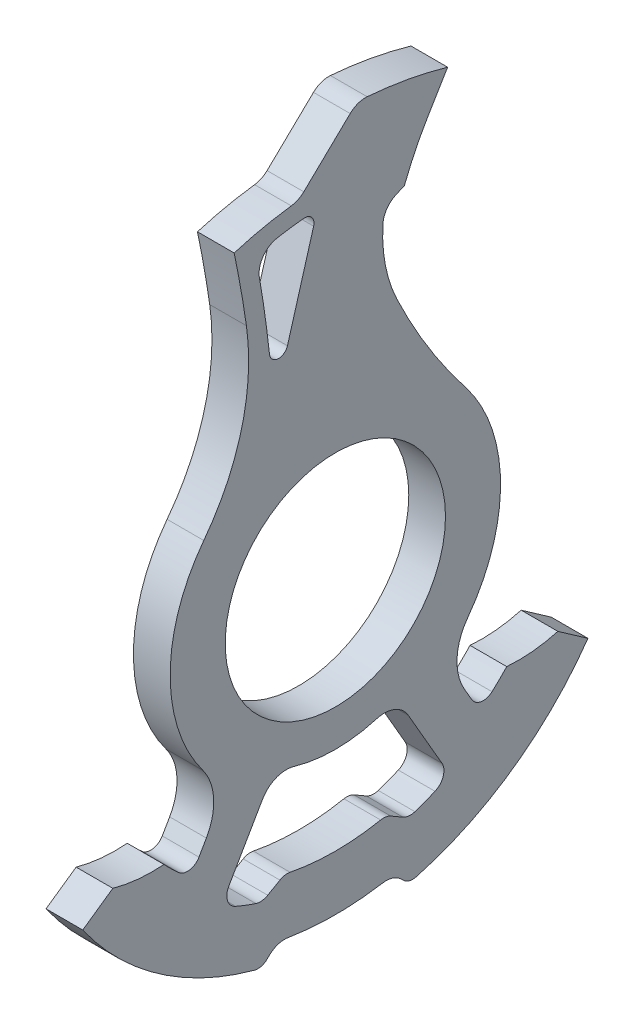
from build123d import *

# Parameters (mm, degrees)
SKETCH2_R           = 38.1
BOSS_EXTRUDE1_DEPTH = 6.35
CUT_EXTRUDE1_DEPTH  = 166.096382574
FILLET1_R           = 7.62
FILLET4_R           = 19.05
FILLET2_R           = 4.572
CUT_EXTRUDE2_DEPTH  = 165.922168179
FILLET3_R           = 5.08
FILLET5_R           = 9.525


with BuildPart() as part:
    # Sketch2 → Boss-Extrude1 (new, symmetric)
    with BuildSketch(Plane(origin=(0, 0, 0), x_dir=(0, 0, -1), z_dir=(1, 0, 0))):
        with BuildLine():
            Line((38.857972086, 134.186988957), (32.288511437, 123.318125779))
            ThreePointArc((32.288511437, 123.318125779), (27.710359244, 114.938607951), (23.879951403, 106.191964463))
            Line((23.879951403, 106.191964463), (16.910644846, 103.110866265))
            Line((16.910644846, 103.110866265), (16.656554589, 100.752761272))
            ThreePointArc((16.656554589, 100.752761272), (17.081157757, 86.805782836), (21.28431641, 73.500447339))
            ThreePointArc((21.28431641, 73.500447339), (32.060560856, 53.735826371), (44.956935904, 35.284506715))
            ThreePointArc((44.956935904, 35.284506715), (56.9039122, -5.297855828), (37.670623819, -42.977280057))
            Line((37.670623819, -42.977280057), (49.900086632, -64.159330998))
            ThreePointArc((49.900086632, -64.159330998), (54.760018309, -60.06478831), (59.285209805, -55.603078137))
            ThreePointArc((59.285209805, -55.603078137), (68.209440684, -55.534234835), (76.983909122, -53.904713488))
            Line((76.983909122, -53.904713488), (87.387140085, -61.18913423))
            ThreePointArc((87.387140085, -61.18913423), (60.250819498, -88.036703424), (25.4, -103.612076516))
            Line((25.4, -103.612076516), (20.08663208, -98.298708596))
            ThreePointArc((20.08663208, -98.298708596), (0, -100.33), (-20.08663208, -98.298708596))
            Line((-20.08663208, -98.298708596), (-25.4, -103.612076516))
            ThreePointArc((-25.4, -103.612076516), (-60.250819498, -88.036703424), (-87.387140085, -61.18913423))
            Line((-87.387140085, -61.18913423), (-76.983909122, -53.904713488))
            ThreePointArc((-76.983909122, -53.904713488), (-68.209440684, -55.534234835), (-59.285209805, -55.603078137))
            ThreePointArc((-59.285209805, -55.603078137), (-54.760018309, -60.06478831), (-49.900086632, -64.159330998))
            Line((-49.900086632, -64.159330998), (-37.670623819, -42.977280057))
            ThreePointArc((-37.670623819, -42.977280057), (-56.860198416, -5.74807238), (-45.50982475, 34.568458908))
            ThreePointArc((-45.50982475, 34.568458908), (-32.417804081, 61.576670544), (-30.771162792, 91.545538949))
            ThreePointArc((-30.771162792, 91.545538949), (-32.69751447, 103.536635229), (-35.005069856, 115.46024244))
            ThreePointArc((-35.005069856, 115.46024244), (-23.992858561, 118.24028602), (-12.768025153, 119.972496989))
            Line((-12.768025153, 119.972496989), (7.554913188, 139.495567265))
            ThreePointArc((7.554913188, 139.495567265), (23.357744557, 137.733459149), (38.857972086, 134.186988957))
        make_face()
        Circle(SKETCH2_R, mode=Mode.SUBTRACT)
    extrude(amount=BOSS_EXTRUDE1_DEPTH, both=True)

    # Sketch3 → Cut-Extrude1 (cut, through all)
    with BuildSketch(Plane(origin=(6.35, 0, 0), x_dir=(0, 0, -1), z_dir=(1, 0, 0))):
        with BuildLine():
            Line((-7.512977292, 109.738721888), (-16.576184766, 78.441038142))
            ThreePointArc((-16.576184766, 78.441038142), (-19.901101363, 76.161124206), (-22.78229081, 78.981022307))
            ThreePointArc((-22.78229081, 78.981022307), (-24.862407335, 94.998613906), (-27.608487184, 110.915559934))
            ThreePointArc((-27.608487184, 110.915559934), (-19.289815116, 112.660521181), (-10.864472489, 113.782482121))
            ThreePointArc((-10.864472489, 113.782482121), (-8.118145596, 112.647905196), (-7.512977292, 109.738721888))
        make_face()
    extrude(amount=-CUT_EXTRUDE1_DEPTH, mode=Mode.SUBTRACT)

    # Fillet1
    fillet1_edges = [part.edges().sort_by_distance(p)[0] for p in [
        (0, 103.110866265, -16.910644846),
        (0, 110.915559934, 27.608487184),
        (0, 139.495567265, -7.554913188),
        (0, 119.972496989, 12.768025153),
        (0, -98.298708596, -20.08663208),
        (0, -98.298708596, 20.08663208),
    ]]
    fillet(fillet1_edges, radius=FILLET1_R)

    # Fillet4
    fillet4_edges = [part.edges().sort_by_distance(p)[0] for p in [
        (0, -42.977280057, -37.670623819),
        (0, -42.977280057, 37.670623819),
    ]]
    fillet(fillet4_edges, radius=FILLET4_R)

    # Fillet2
    fillet2_edges = [part.edges().sort_by_distance(p)[0] for p in [
        (0, -103.612076516, 25.4),
        (0, -103.612076516, -25.4),
        (0, -64.159330998, -49.900086632),
        (0, -64.159330998, 49.900086632),
    ]]
    fillet(fillet2_edges, radius=FILLET2_R)

    # Sketch4 → Cut-Extrude2 (cut, through all)
    with BuildSketch(Plane(origin=(6.35, 0, 0), x_dir=(0, 0, -1), z_dir=(1, 0, 0))):
        with BuildLine():
            Line((-21.184299428, -46.172128582), (-39.645963646, -78.148669001))
            ThreePointArc((-39.645963646, -78.148669001), (-32.613253082, -81.335063923), (-25.327366164, -83.890055568))
            Line((-25.327366164, -83.890055568), (-17.5035126, -79.372951606))
            ThreePointArc((-17.5035126, -79.372951606), (-8.803547394, -80.801831373), (0, -81.28))
            Line((0, -81.28), (0, -50.8))
            ThreePointArc((0, -50.8), (-10.841952501, -49.629548315), (-21.184299428, -46.172128582))
        make_face()
    cut_extrude2 = extrude(amount=-CUT_EXTRUDE2_DEPTH, mode=Mode.SUBTRACT)

    # Mirror1: Cut-Extrude2 across plane
    add(cut_extrude2.mirror(Plane(origin=(-6.35, -81.28, 0), x_dir=(1, 0, 0), z_dir=(0, 0, -1))), mode=Mode.SUBTRACT)

    # Fillet3
    fillet3_edges = [part.edges().sort_by_distance(p)[0] for p in [
        (0, -78.148669001, -39.645963646),
        (0, -83.890055568, -25.327366164),
        (0, -79.372951606, -17.5035126),
        (0, -79.372951606, 17.5035126),
        (0, -83.890055568, 25.327366164),
        (0, -78.148669001, 39.645963646),
    ]]
    fillet(fillet3_edges, radius=FILLET3_R)

    # Fillet5
    fillet5_edges = [part.edges().sort_by_distance(p)[0] for p in [
        (0, -46.172128582, -21.184299428),
        (0, -46.172128582, 21.184299428),
    ]]
    fillet(fillet5_edges, radius=FILLET5_R)


solid = part.part
